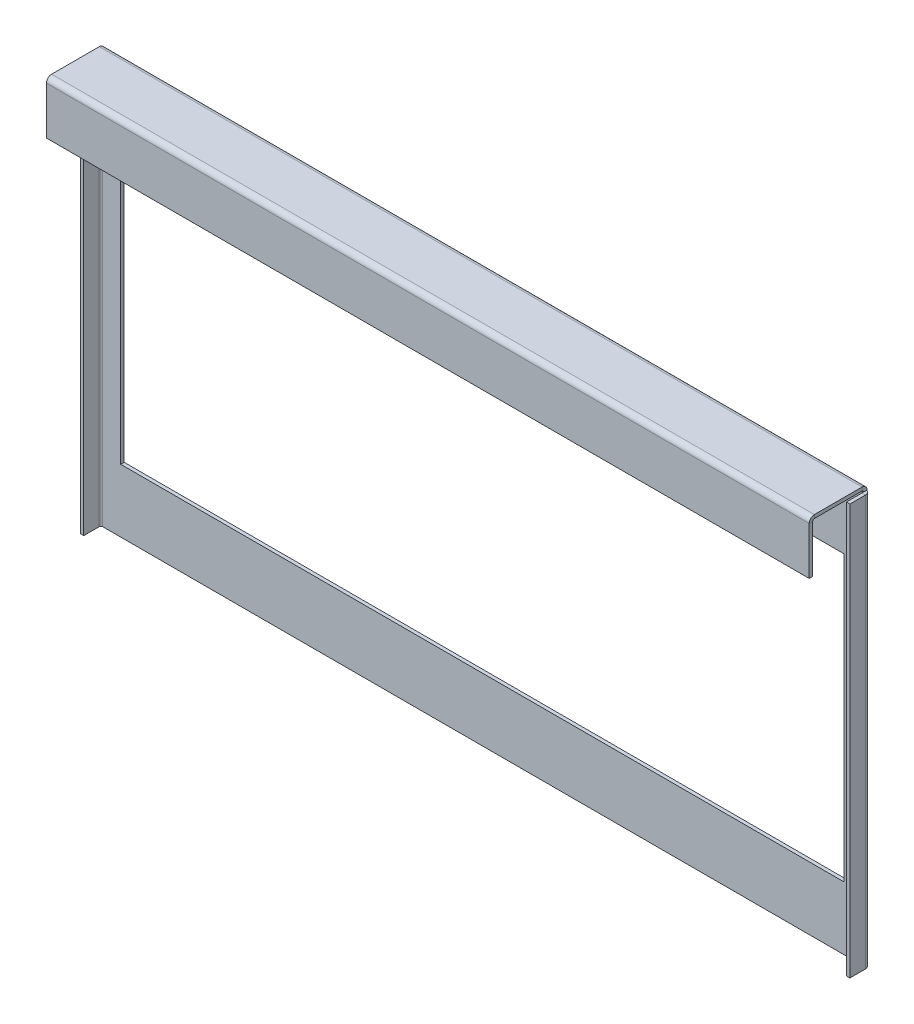
from build123d import *

# Parameters (mm, degrees)
SKETCH1_W                    = 443
SKETCH1_H                    = 300
BASE_FLANGE1_DEPTH           = 2
SKETCHED_START               = -221.5
SKETCHED_BEND1_DEPTH         = 443
SKETCHED_BEND1_2_DEPTH       = 443
SKETCHED_BEND2_DEPTH         = 443
SKETCHED_BEND2_2_DEPTH       = 443
EDGE_FLANGE1_STRIP_W         = 10
EDGE_FLANGE1_STRIP_H         = 2
EDGE_FLANGE1_STRIP_CUT_DEPTH = 238.429203673
EDGE_FLANGE1_DEPTH           = 238.429203673
EDGE_FLANGE2_STRIP_W         = 10
EDGE_FLANGE2_STRIP_H         = 2
EDGE_FLANGE2_STRIP_CUT_DEPTH = 238.429203673
EDGE_FLANGE2_DEPTH           = 238.429203673
SKETCH15_W                   = 420
SKETCH15_H                   = 165
CUT_EXTRUDE1_DEPTH           = 272.023210126


# Read off the part's stored shape, not the designer's step: Sketched Bend1, Sketched Bend2
# Sheet-metal steps are written as plain solids
with BuildPart() as part:
    # Sketch1 → Base-Flange1 (new body)
    with BuildSketch(Plane.XY):
        Rectangle(SKETCH1_W, SKETCH1_H)
    extrude(amount=-BASE_FLANGE1_DEPTH)

    # Sketched Bend1 outline → Sketched Bend1 (cut)
    with BuildSketch(Plane.YZ.offset(SKETCHED_START)):
        with BuildLine():
            Line((150, 0), (91.257630798, 0))
            ThreePointArc((91.257630798, 0), (90.161254481, -1.449489743), (88.429203673, -2))
            Line((88.429203673, -2), (150, -2))
            Line((150, -2), (150, 0))
        make_face()
    extrude(amount=SKETCHED_BEND1_DEPTH, mode=Mode.SUBTRACT)

    # Sketched Bend1 2 outline → Sketched Bend1 2 (add)
    with BuildSketch(Plane.YZ.offset(SKETCHED_START)):
        with BuildLine():
            Line((91.429203673, 1), (91.429203673, 59.429203673))
            Line((91.429203673, 59.429203673), (89.429203673, 59.429203673))
            Line((89.429203673, 59.429203673), (89.429203673, 1))
            ThreePointArc((89.429203673, 1), (89.136310454, 0.292893219), (88.429203673, 0))
            Line((88.429203673, 0), (91.257630798, 0))
            ThreePointArc((91.257630798, 0), (91.385999352, 0.492694064), (91.429203673, 1))
        make_face()
    extrude(amount=SKETCHED_BEND1_2_DEPTH)

    # Sketched Bend2 outline → Sketched Bend2 (cut)
    with BuildSketch(Plane.YZ.offset(SKETCHED_START)):
        with BuildLine():
            ThreePointArc((89.429203673, 31.472232635), (90.878693416, 30.375856318), (91.429203673, 28.64380551))
            Line((91.429203673, 28.64380551), (91.429203673, 59.429203673))
            Line((91.429203673, 59.429203673), (89.429203673, 59.429203673))
            Line((89.429203673, 59.429203673), (89.429203673, 31.472232635))
        make_face()
    extrude(amount=SKETCHED_BEND2_DEPTH, mode=Mode.SUBTRACT)

    # Sketched Bend2 2 outline → Sketched Bend2 2 (add)
    with BuildSketch(Plane.YZ.offset(SKETCHED_START)):
        with BuildLine():
            Line((89.429203673, 28.64380551), (89.429203673, 31.472232635))
            ThreePointArc((89.429203673, 31.472232635), (88.936509609, 31.600601189), (88.429203673, 31.64380551))
            Line((88.429203673, 31.64380551), (60.785398163, 31.64380551))
            Line((60.785398163, 31.64380551), (60.785398163, 29.64380551))
            Line((60.785398163, 29.64380551), (88.429203673, 29.64380551))
            ThreePointArc((88.429203673, 29.64380551), (89.136310454, 29.350912291), (89.429203673, 28.64380551))
        make_face()
    extrude(amount=SKETCHED_BEND2_2_DEPTH)

    # Edge-Flange1 strip (across the edge) → Edge-Flange1 strip cut (cut)
    with BuildSketch(Plane(origin=(-221.5, 88.429203673, 0), x_dir=(1, 0, 0), z_dir=(0, -1, 0))):
        with Locations((-4, -1)):
            Rectangle(EDGE_FLANGE1_STRIP_W, EDGE_FLANGE1_STRIP_H)
    extrude(amount=EDGE_FLANGE1_STRIP_CUT_DEPTH, mode=Mode.SUBTRACT)

    # Edge-Flange1 section (across the edge) → Edge-Flange1 (add)
    with BuildSketch(Plane(origin=(-221.5, 88.429203673, 0), x_dir=(1, 0, 0), z_dir=(0, -1, 0))):
        with BuildLine():
            Line((-2, 1), (-2, 10))
            Line((-2, 10), (0, 10))
            Line((0, 10), (0, 1))
            ThreePointArc((0, 1), (0.292893219, 0.292893219), (1, 0))
            Line((1, 0), (1, -2))
            ThreePointArc((1, -2), (-1.121320344, -1.121320344), (-2, 1))
        make_face()
    extrude(amount=EDGE_FLANGE1_DEPTH)

    # Edge-Flange2 strip (across the edge) → Edge-Flange2 strip cut (cut)
    with BuildSketch(Plane(origin=(221.5, -150, 0), x_dir=(-1, 0, 0), z_dir=(0, 1, 0))):
        with Locations((-4, -1)):
            Rectangle(EDGE_FLANGE2_STRIP_W, EDGE_FLANGE2_STRIP_H)
    extrude(amount=EDGE_FLANGE2_STRIP_CUT_DEPTH, mode=Mode.SUBTRACT)

    # Edge-Flange2 section (across the edge) → Edge-Flange2 (add)
    with BuildSketch(Plane(origin=(221.5, -150, 0), x_dir=(-1, 0, 0), z_dir=(0, 1, 0))):
        with BuildLine():
            Line((-2, 1), (-2, 10))
            Line((-2, 10), (0, 10))
            Line((0, 10), (0, 1))
            ThreePointArc((0, 1), (0.292893219, 0.292893219), (1, 0))
            Line((1, 0), (1, -2))
            ThreePointArc((1, -2), (-1.121320344, -1.121320344), (-2, 1))
        make_face()
    extrude(amount=EDGE_FLANGE2_DEPTH)

    # Sketch15 → Cut-Extrude1 (cut, through all)
    with BuildSketch(Plane.XY):
        with Locations((0, -30.864518484)):
            Rectangle(SKETCH15_W, SKETCH15_H)
    extrude(amount=-CUT_EXTRUDE1_DEPTH, mode=Mode.SUBTRACT)


solid = part.part
